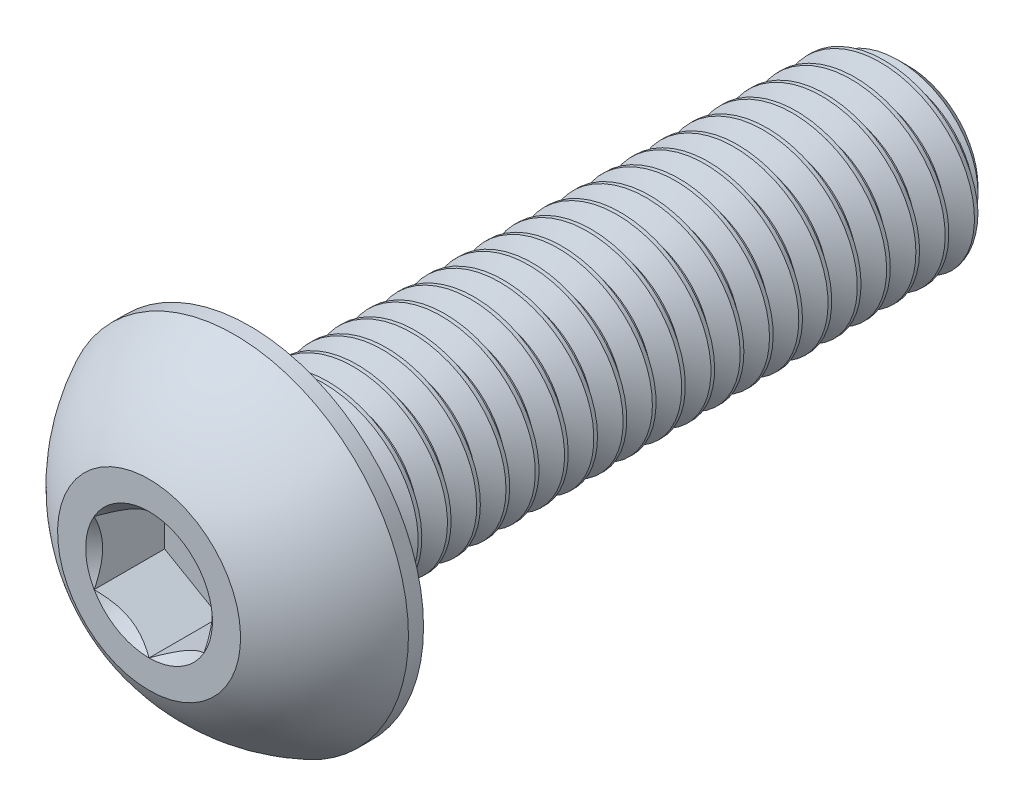
from build123d import *

# Parameters (mm, degrees)
CUT_EXTRUDE2_DEPTH = 1.925
CUT_SWEEP2_PITCH   = 0.8
CUT_SWEEP2_TO      = 18


with BuildPart() as part:
    # Sketch10 → Revolve3 (revolve)
    with BuildSketch(Plane(origin=(0, 0, 0), x_dir=(0, 0, -1), z_dir=(1, 0, 0)), mode=Mode.PRIVATE) as revolve3_sk:
        Polygon((20.15, 2.5), (20.75, 1.9), (20.75, 0), (2.75, 0), (2.75, 2.5), align=None)
    revolve(revolve3_sk.sketch.rotate(Axis((0, 0, 0), (0, 0, -1)), 90), axis=Axis((0, 0, 0), (0, 0, -1)))

    # Sketch7 → Revolve2 (revolve)
    with BuildSketch(Plane(origin=(0, 0, 0), x_dir=(0, 0, -1), z_dir=(1, 0, 0)), mode=Mode.PRIVATE) as revolve2_sk:
        with BuildLine():
            Line((2.3375, 4.75), (2.75, 4.75))
            Line((2.75, 4.75), (2.75, 0))
            Line((2.75, 0), (0, 0))
            Line((0, 0), (0, 2.5))
            ThreePointArc((0, 2.5), (0.991875183, 3.808753282), (2.3375, 4.75))
        make_face()
    revolve(revolve2_sk.sketch.rotate(Axis((0, 0, 0), (0, 0, -1)), 180), axis=Axis((0, 0, 0), (0, 0, -1)))

    # Sketch5 → Cut-Extrude2 (cut)
    with BuildSketch(Plane.XY):
        Polygon((1.5, -0.866025404), (1.5, 0.866025404), (0, 1.732050808), (-1.5, 0.866025404), (-1.5, -0.866025404), (0, -1.732050808), align=None)
    extrude(amount=-CUT_EXTRUDE2_DEPTH, mode=Mode.SUBTRACT)

    # Cut-Extrude3 cone 1 section (through the dimple's axis) → Cut-Extrude3 (revolve, cut)
    with BuildSketch(Plane(origin=(0, 0, 0), x_dir=(0, -1, 0), z_dir=(1, 0, 0))):
        Polygon((0, 0), (1.732050808, 0), (0, 1.732050808), align=None)
    revolve(axis=Axis((0, 0, 0), (0, 0, -1)), mode=Mode.SUBTRACT)


with BuildPart() as body_2:
    # Split1: read off the stored shape, not the designer's step
    # Split1: the piece on the far side of the plane
    add(part.part)
    split(bisect_by=Plane.XY.offset(-2.75), keep=Keep.BOTTOM)

    # Cut-Sweep2: arcs per turn and ends read off the stored shape
    # Cut-Sweep2: the profile of Sketch12 screwed along a right-hand helix through 27 turns, 8 arcs to a turn; built about Z, then put on its axis
    cut_sweep2_z = Axis((0, 0, 0), (0, 0, 1))
    cut_sweep2_corners = [(1.980384758, 0, -0.3), (1.980384758, 0, -0.4), (2.54330127, 0, -0.725), (2.54330127, 0, 0.025)]
    with BuildLine(mode=Mode.PRIVATE) as cut_sweep2_profile:
        Line(cut_sweep2_corners[0], cut_sweep2_corners[1])
        Line(cut_sweep2_corners[1], cut_sweep2_corners[2])
        Line(cut_sweep2_corners[2], cut_sweep2_corners[3])
        Line(cut_sweep2_corners[3], cut_sweep2_corners[0])
    cut_sweep2_cap = Face(cut_sweep2_profile.wire())
    cut_sweep2_turn_angles = [0, 22.5, 45, 67.5, 90, 112.5, 135, 157.5, 180, 202.5, 225, 247.5, 270, 292.5, 315, 337.5, 360]
    cut_sweep2_turn_weights = [1, 0.9238795325112867, 1, 0.9238795325112867, 1, 0.9238795325112867, 1, 0.9238795325112867, 1, 0.9238795325112867, 1, 0.9238795325112867, 1, 0.9238795325112867, 1, 0.9238795325112867, 1]
    cut_sweep2_turn_rails = [Edge.make_bspline([Vector(p[0], p[1], 0).rotate(cut_sweep2_z, cut_sweep2_turn_angles[k]) / cut_sweep2_turn_weights[k] + Vector(0, 0, p[2] + CUT_SWEEP2_PITCH * cut_sweep2_turn_angles[k] / 360) for k in range(17)], [0, 0, 0, 1, 1, 2, 2, 3, 3, 4, 4, 5, 5, 6, 6, 7, 7, 8, 8, 8], 2, cut_sweep2_turn_weights) for p in cut_sweep2_corners]
    cut_sweep2_turn_sides = [Face.make_surface_from_curves(cut_sweep2_turn_rails[p[0]], cut_sweep2_turn_rails[p[1]]) for p in [(0, 1), (1, 2), (2, 3), (3, 0)]]
    cut_sweep2 = Plane(origin=(0, 0, -20.75), x_dir=(0, 1, 0), z_dir=(0, 0, 1)) * split(Solid(Shell([*[p.moved(Location((0, 0, CUT_SWEEP2_PITCH * i))) for i in range(27) for p in cut_sweep2_turn_sides], cut_sweep2_cap, cut_sweep2_cap.rotate(cut_sweep2_z, 9720).moved(Location((0, 0, CUT_SWEEP2_PITCH * 9720 / 360)))])), bisect_by=Plane.XY.offset(CUT_SWEEP2_TO), keep=Keep.BOTTOM, mode=Mode.PRIVATE)
    add(cut_sweep2, mode=Mode.SUBTRACT)


with BuildPart() as part_1:
    add(part.part)

    # Split1
    split(bisect_by=Plane.XY.offset(-2.75), keep=Keep.TOP)

    add(body_2.part)  # Boss-Extrude1 merges body 2
    # Boss-Extrude1: read off the stored shape, not the designer's step
    # Boss-Extrude1 outline → Boss-Extrude1 (revolve)
    with BuildSketch(Plane.XZ):
        Polygon((1.980384758, -2.75), (1.980384758, -3.269615242), (2.5, -2.75), align=None)
    revolve(axis=Axis((0, 0, 0), (0, 0, 1)))


solid = part_1.part
